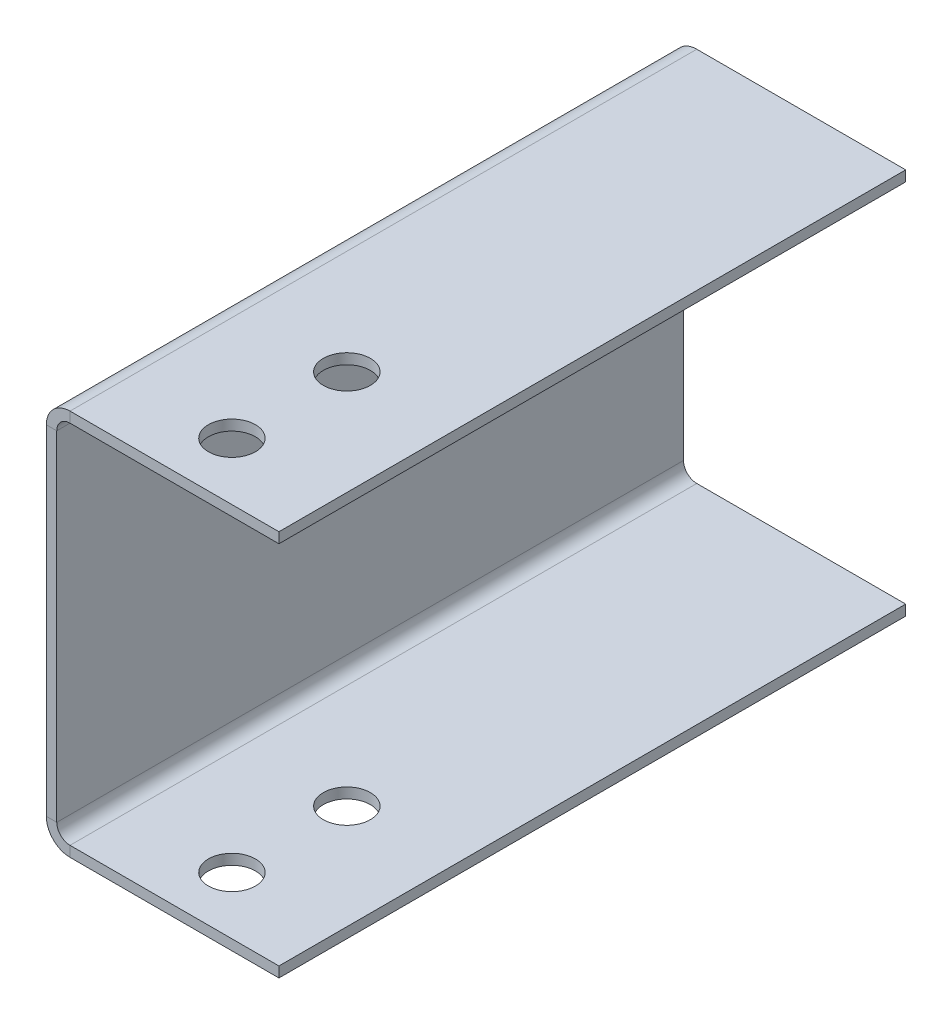
from build123d import *

# Parameters (mm, degrees)
SKETCH1_W              = 22.27
SKETCH1_H              = 37
BOSS_EXTRUDE1_DEPTH    = 60
SHELL1_T               = -1
CONVERT_SOLID1_DEPTH   = 60
CONVERT_SOLID1_2_DEPTH = 60
SKETCH6_R              = 2.25
CUT_EXTRUDE1_DEPTH     = 72.365175156


# Read off the part's stored shape, not the designer's step: Convert-Solid1
with BuildPart() as part:
    # Sketch1 → Boss-Extrude1 (new body)
    with BuildSketch(Plane.XY):
        Rectangle(SKETCH1_W, SKETCH1_H)
    extrude(amount=BOSS_EXTRUDE1_DEPTH)

    # Shell1
    shell1_openings = [part.faces().sort_by_distance(p)[0] for p in [
        (0, 0, 60),
        (0, 0, 0),
        (11.135, 0, 30),
    ]]
    offset(amount=SHELL1_T, openings=shell1_openings, kind=Kind.INTERSECTION)

    # Convert-Solid1 outline → Convert-Solid1 (cut)
    with BuildSketch(Plane.XY):
        with BuildLine():
            Line((-11.135, 18.5), (-11.135, 16.23))
            ThreePointArc((-11.135, 16.23), (-10.470132393, 17.835132393), (-8.865, 18.5))
            Line((-8.865, 18.5), (-11.135, 18.5))
        make_face()
        with BuildLine():
            ThreePointArc((-8.865, -18.5), (-10.470132393, -17.835132393), (-11.135, -16.23))
            Line((-11.135, -16.23), (-11.135, -18.5))
            Line((-11.135, -18.5), (-8.865, -18.5))
        make_face()
    extrude(amount=CONVERT_SOLID1_DEPTH, mode=Mode.SUBTRACT)

    # Convert-Solid1 2 outline → Convert-Solid1 2 (add)
    with BuildSketch(Plane.XY):
        with BuildLine():
            Line((-10.135, 17.5), (-10.135, 16.23))
            ThreePointArc((-10.135, 16.23), (-9.763025612, 17.128025612), (-8.865, 17.5))
            Line((-8.865, 17.5), (-10.135, 17.5))
        make_face()
        with BuildLine():
            ThreePointArc((-8.865, -17.5), (-9.763025612, -17.128025612), (-10.135, -16.23))
            Line((-10.135, -16.23), (-10.135, -17.5))
            Line((-10.135, -17.5), (-8.865, -17.5))
        make_face()
    extrude(amount=CONVERT_SOLID1_2_DEPTH)

    # Sketch6 → Cut-Extrude1 (cut, through all)
    with BuildSketch(Plane(origin=(0, 18.5, 0), x_dir=(1, 0, 0), z_dir=(0, 1, 0))):
        with Locations(Location((1.135, -43.5, 0), (0, 0, 270))):
            Circle(SKETCH6_R)
        with Locations(Location((1.135, -54.5, 0), (0, 0, 270))):
            Circle(SKETCH6_R)
    extrude(amount=-CUT_EXTRUDE1_DEPTH, mode=Mode.SUBTRACT)


solid = part.part
